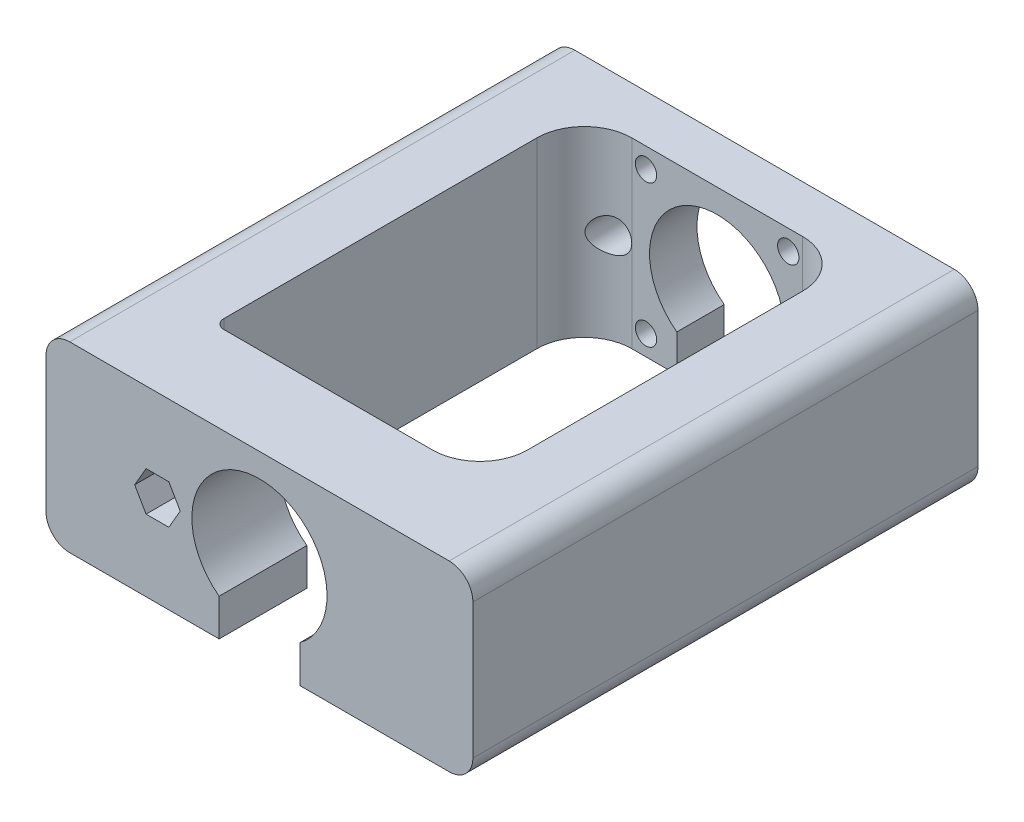
from build123d import *

# Parameters (mm, degrees)
SKETCH1_R             = 2.25
BOSS_EXTRUDE1_DEPTH   = 10
BOSS_EXTRUDE3_DEPTH   = 78
BOSS_EXTRUDE3_2_DEPTH = 78
SKETCH4_R             = 3.5
BOSS_EXTRUDE4_DEPTH   = 10
BOSS_EXTRUDE5_DEPTH   = 8.5
SKETCH5_R             = 3.5
CUT_EXTRUDE1_DEPTH    = 110.542514578
FILLET2_R             = 2
FILLET3_R             = 10


with BuildPart() as part:
    # Sketch1 → Boss-Extrude1 (new body)
    with BuildSketch(Plane.XY):
        with BuildLine():
            Line((15, 19.25), (-15, 19.25))
            Line((-15, 19.25), (-30, 19.25))
            Line((-30, 19.25), (-40, 19.25))
            ThreePointArc((-40, 19.25), (-43.535533906, 17.785533906), (-45, 14.25))
            Line((-45, 14.25), (-45, -14.25))
            ThreePointArc((-45, -14.25), (-43.535533906, -17.785533906), (-40, -19.25))
            Line((-40, -19.25), (-30, -19.25))
            Line((-30, -19.25), (-15, -19.25))
            Line((-15, -19.25), (-8.5, -19.25))
            Line((-8.5, -19.25), (-8.5, -16.75))
            Line((-8.5, -16.75), (-8.5, -11.437329234))
            ThreePointArc((-8.5, -11.437329234), (0, 14.25), (8.5, -11.437329234))
            Line((8.5, -11.437329234), (8.5, -16.75))
            Line((8.5, -16.75), (8.5, -19.25))
            Line((8.5, -19.25), (15, -19.25))
            Line((15, -19.25), (30, -19.25))
            Line((30, -19.25), (40, -19.25))
            ThreePointArc((40, -19.25), (43.535533906, -17.785533906), (45, -14.25))
            Line((45, -14.25), (45, 14.25))
            ThreePointArc((45, 14.25), (43.535533906, 17.785533906), (40, 19.25))
            Line((40, 19.25), (30, 19.25))
            Line((30, 19.25), (15, 19.25))
        make_face()
        with Locations((-15, -15)):
            Circle(SKETCH1_R, mode=Mode.SUBTRACT)
        with Locations((15, -15)):
            Circle(SKETCH1_R, mode=Mode.SUBTRACT)
        with Locations((-15, 15)):
            Circle(SKETCH1_R, mode=Mode.SUBTRACT)
        with Locations((15, 15)):
            Circle(SKETCH1_R, mode=Mode.SUBTRACT)
    extrude(amount=BOSS_EXTRUDE1_DEPTH)

    # Sketch5 → Cut-Extrude1 (cut, through all)
    with BuildSketch(Plane.XY.offset(98)):
        with Locations((-21.5, 0)):
            Circle(SKETCH5_R)
    extrude(amount=-CUT_EXTRUDE1_DEPTH, mode=Mode.SUBTRACT)


with BuildPart() as body_2:
    # Sketch2 → Boss-Extrude3 (new body)
    with BuildSketch(Plane.XY.offset(10)):
        with BuildLine():
            Line((-45, 14.25), (-45, -14.25))
            ThreePointArc((-45, -14.25), (-43.535533906, -17.785533906), (-40, -19.25))
            Line((-40, -19.25), (-28, -19.25))
            Line((-28, -19.25), (-28, 0))
            Line((-28, 0), (-28, 19.25))
            Line((-28, 19.25), (-40, 19.25))
            ThreePointArc((-40, 19.25), (-43.535533906, 17.785533906), (-45, 14.25))
        make_face()
    extrude(amount=BOSS_EXTRUDE3_DEPTH)

    # Sketch4 → Boss-Extrude4 (add)
    with BuildSketch(Plane.XY.offset(88)):
        with BuildLine():
            Line((-45, 14.25), (-45, -14.25))
            ThreePointArc((-45, -14.25), (-43.535533906, -17.785533906), (-40, -19.25))
            Line((-40, -19.25), (-8.5, -19.25))
            Line((-8.5, -19.25), (-8.5, -11.437329234))
            ThreePointArc((-8.5, -11.437329234), (0, 14.25), (8.5, -11.437329234))
            Line((8.5, -11.437329234), (8.5, -19.25))
            Line((8.5, -19.25), (40, -19.25))
            ThreePointArc((40, -19.25), (43.535533906, -17.785533906), (45, -14.25))
            Line((45, -14.25), (45, 14.25))
            ThreePointArc((45, 14.25), (43.535533906, 17.785533906), (40, 19.25))
            Line((40, 19.25), (-40, 19.25))
            ThreePointArc((-40, 19.25), (-43.535533906, 17.785533906), (-45, 14.25))
        make_face()
        with Locations((-21.5, 0)):
            Circle(SKETCH4_R, mode=Mode.SUBTRACT)
    extrude(amount=BOSS_EXTRUDE4_DEPTH)

    # Sketch6 → Boss-Extrude5 (add)
    with BuildSketch(Plane.XY.offset(98)):
        with BuildLine():
            Line((-40, -19.25), (-8.5, -19.25))
            Line((-8.5, -19.25), (-8.5, -11.437329234))
            ThreePointArc((-8.5, -11.437329234), (0, 14.25), (8.5, -11.437329234))
            Line((8.5, -11.437329234), (8.5, -19.25))
            Line((8.5, -19.25), (40, -19.25))
            ThreePointArc((40, -19.25), (43.535533906, -17.785533906), (45, -14.25))
            Line((45, -14.25), (45, 14.25))
            ThreePointArc((45, 14.25), (43.535533906, 17.785533906), (40, 19.25))
            Line((40, 19.25), (-40, 19.25))
            ThreePointArc((-40, 19.25), (-43.535533906, 17.785533906), (-45, 14.25))
            Line((-45, 14.25), (-45, -14.25))
            ThreePointArc((-45, -14.25), (-43.535533906, -17.785533906), (-40, -19.25))
        make_face()
        Polygon((-16.7, 0), (-19.1, 4.156921938), (-23.9, 4.156921938), (-26.3, 0), (-23.9, -4.156921938), (-19.1, -4.156921938), align=None, mode=Mode.SUBTRACT)
    extrude(amount=BOSS_EXTRUDE5_DEPTH)


with BuildPart() as body_3:
    # Sketch2 → Boss-Extrude3 2 (new body)
    with BuildSketch(Plane.XY.offset(10)):
        with BuildLine():
            Line((40, -19.25), (28, -19.25))
            Line((28, -19.25), (28, 0))
            Line((28, 0), (28, 19.25))
            Line((28, 19.25), (40, 19.25))
            ThreePointArc((40, 19.25), (43.535533906, 17.785533906), (45, 14.25))
            Line((45, 14.25), (45, -14.25))
            ThreePointArc((45, -14.25), (43.535533906, -17.785533906), (40, -19.25))
        make_face()
    extrude(amount=BOSS_EXTRUDE3_2_DEPTH)


with BuildPart() as part_1:
    add(part.part)

    # Combine1: union body 2, body 3
    add(body_2.part)
    add(body_3.part)

    # Fillet2
    fillet2_edges = [part_1.edges().sort_by_distance(p)[0] for p in [
        (-28, 0, 88),
    ]]
    fillet(fillet2_edges, radius=FILLET2_R)

    # Fillet3
    # the kernel refuses this fillet: 10 mm, written as the material it adds along each edge
    with BuildSketch(Plane(origin=(28, -19.25, 88), x_dir=(-1, 0, 0), z_dir=(0, 1, 0))) as fillet3_piece_1:
        with BuildLine():
            CenterArc((FILLET3_R, -FILLET3_R), FILLET3_R, 90, 90)
            Line((0, -FILLET3_R), (-FILLET3_R * 0.02, -FILLET3_R))
            Line((-FILLET3_R * 0.02, -FILLET3_R), (-FILLET3_R * 0.02, FILLET3_R * 0.02))
            Line((-FILLET3_R * 0.02, FILLET3_R * 0.02), (FILLET3_R, FILLET3_R * 0.02))
            Line((FILLET3_R, FILLET3_R * 0.02), (FILLET3_R, 0))
        make_face()
    extrude(amount=38.5)
    with BuildSketch(Plane(origin=(-28, -19.25, 10), x_dir=(0, 0, 1), z_dir=(0, 1, 0))) as fillet3_piece_2_section:
        with BuildLine():
            CenterArc((FILLET3_R, FILLET3_R), FILLET3_R, 180, 90)
            Line((0, FILLET3_R), (-FILLET3_R * 0.02, FILLET3_R))
            Line((-FILLET3_R * 0.02, FILLET3_R), (-FILLET3_R * 0.02, -FILLET3_R * 0.02))
            Line((-FILLET3_R * 0.02, -FILLET3_R * 0.02), (FILLET3_R, -FILLET3_R * 0.02))
            Line((FILLET3_R, -FILLET3_R * 0.02), (FILLET3_R, 0))
        make_face()
    fillet3_piece_2 = extrude(amount=38.5, mode=Mode.PRIVATE)
    fillet3_piece_2 = fillet3_piece_2 - Plane(origin=(-21.5, 0, 12.335340949), x_dir=(1, 0, 0), z_dir=(0, 0, 1)) * Cylinder(3.5, 117, mode=Mode.PRIVATE)
    add(fillet3_piece_2)
    with BuildSketch(Plane(origin=(28, 19.25, 10), x_dir=(0, 0, 1), z_dir=(0, -1, 0))) as fillet3_piece_3:
        with BuildLine():
            CenterArc((FILLET3_R, FILLET3_R), FILLET3_R, 180, 90)
            Line((0, FILLET3_R), (-FILLET3_R * 0.02, FILLET3_R))
            Line((-FILLET3_R * 0.02, FILLET3_R), (-FILLET3_R * 0.02, -FILLET3_R * 0.02))
            Line((-FILLET3_R * 0.02, -FILLET3_R * 0.02), (FILLET3_R, -FILLET3_R * 0.02))
            Line((FILLET3_R, -FILLET3_R * 0.02), (FILLET3_R, 0))
        make_face()
    extrude(amount=38.5)


solid = part_1.part
